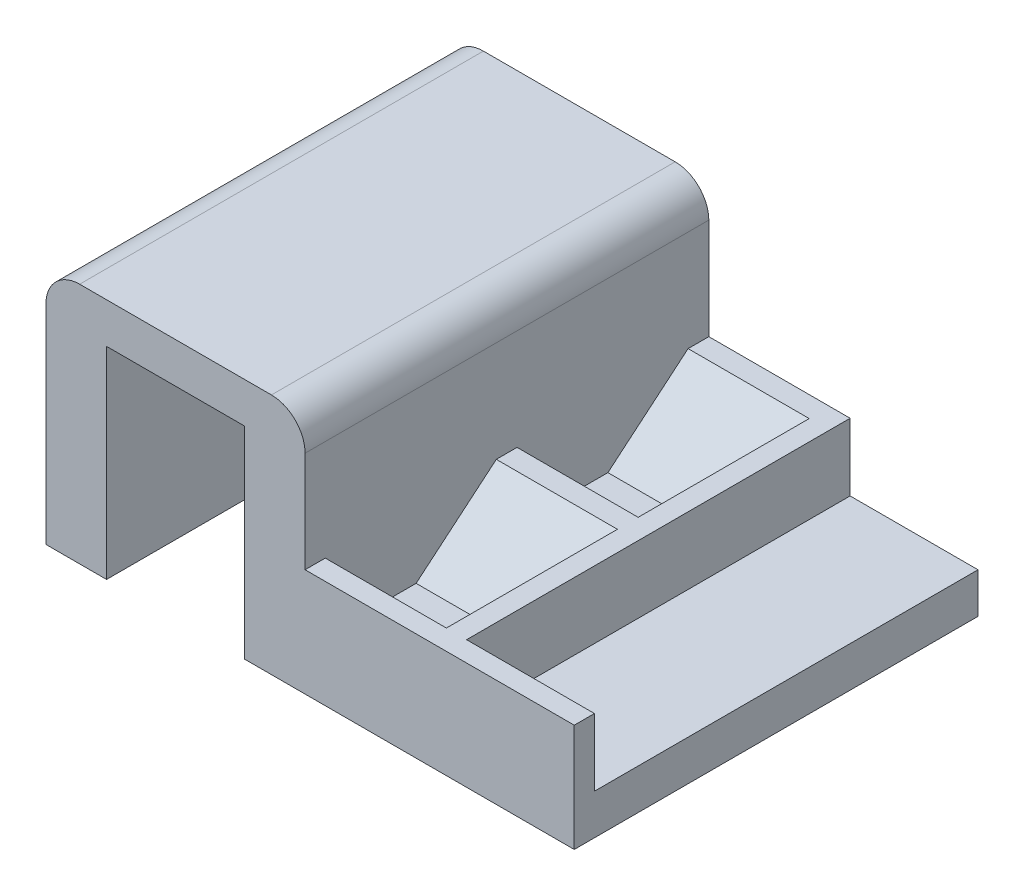
from build123d import *

# Parameters (mm, degrees)
BOSS_EXTRUDE1_DEPTH = 60
SKETCH2_W           = 18
SKETCH2_H           = 3
BOSS_EXTRUDE2_DEPTH = 10
CHAMFER1_SIZE       = 10.069195574
CHAMFER1_SIZE_2     = 12
FILLET1_R           = 5


with BuildPart() as part:
    # Sketch1 → Boss-Extrude1 (new body)
    with BuildSketch(Plane.XY):
        Polygon((0, 0), (0, 30), (20.5, 30), (20.5, 0), (69.5, 0), (69.5, 6), (29.5, 6), (29.5, 36), (-9, 36), (-9, 0), align=None)
    extrude(amount=BOSS_EXTRUDE1_DEPTH)

    # Sketch2 → Boss-Extrude2 (add)
    with BuildSketch(Plane(origin=(0, 6, 0), x_dir=(1, 0, 0), z_dir=(0, 1, 0))):
        with Locations((38.5, -1.5)):
            Rectangle(SKETCH2_W, SKETCH2_H)
        Polygon((50.5, 0), (47.5, 0), (47.5, -3), (47.5, -28.5), (47.5, -31.5), (47.5, -57), (47.5, -60), (69.5, -60), (69.5, -57), (50.5, -57), align=None)
        with Locations((38.5, -30)):
            Rectangle(SKETCH2_W, SKETCH2_H)
        with Locations((38.5, -58.5)):
            Rectangle(SKETCH2_W, SKETCH2_H)
    extrude(amount=BOSS_EXTRUDE2_DEPTH)

    # Chamfer1
    # the kernel refuses this chamfer: 12, 10.069195574 mm, written as the material it adds along each edge
    with BuildSketch(Plane(origin=(29.5, 6, 31.5), x_dir=(0, 0.9993728857116145, -0.03540953691366269), z_dir=(1, 0, 0))) as chamfer1_piece_1_section:
        Polygon((CHAMFER1_SIZE * 0.999372885724, CHAMFER1_SIZE * 0.0354095369141), (-CHAMFER1_SIZE_2 * 0.0354095369137, CHAMFER1_SIZE_2 * 0.999372885712), (0, 0), align=None)
    chamfer1_piece_1 = extrude(amount=18, mode=Mode.PRIVATE)
    chamfer1_piece_1 = split(chamfer1_piece_1, bisect_by=Plane(origin=(38.5, 16, 35.487012509), z_dir=(0, -1, 0)), keep=Keep.TOP, mode=Mode.PRIVATE)
    add(chamfer1_piece_1)
    with BuildSketch(Plane(origin=(29.5, 6, 3), x_dir=(0, -0.024939322090234344, 0.9996889667359941), z_dir=(1, 0, 0))) as chamfer1_piece_2_section:
        Polygon((CHAMFER1_SIZE_2 * 0.999688966736, -CHAMFER1_SIZE_2 * 0.0249393220902), (-CHAMFER1_SIZE * 0.0249393220905, -CHAMFER1_SIZE * 0.999688966749), (0, 0), align=None)
    chamfer1_piece_2 = extrude(amount=18, mode=Mode.PRIVATE)
    chamfer1_piece_2 = split(chamfer1_piece_2, bisect_by=Plane(origin=(38.5, 16, 6.987012509), z_dir=(0, -1, 0)), keep=Keep.TOP, mode=Mode.PRIVATE)
    add(chamfer1_piece_2)

    # Fillet1
    fillet1_edges = [part.edges().sort_by_distance(p)[0] for p in [
        (-9, 36, 30),
        (29.5, 36, 30),
    ]]
    fillet(fillet1_edges, radius=FILLET1_R)


solid = part.part
